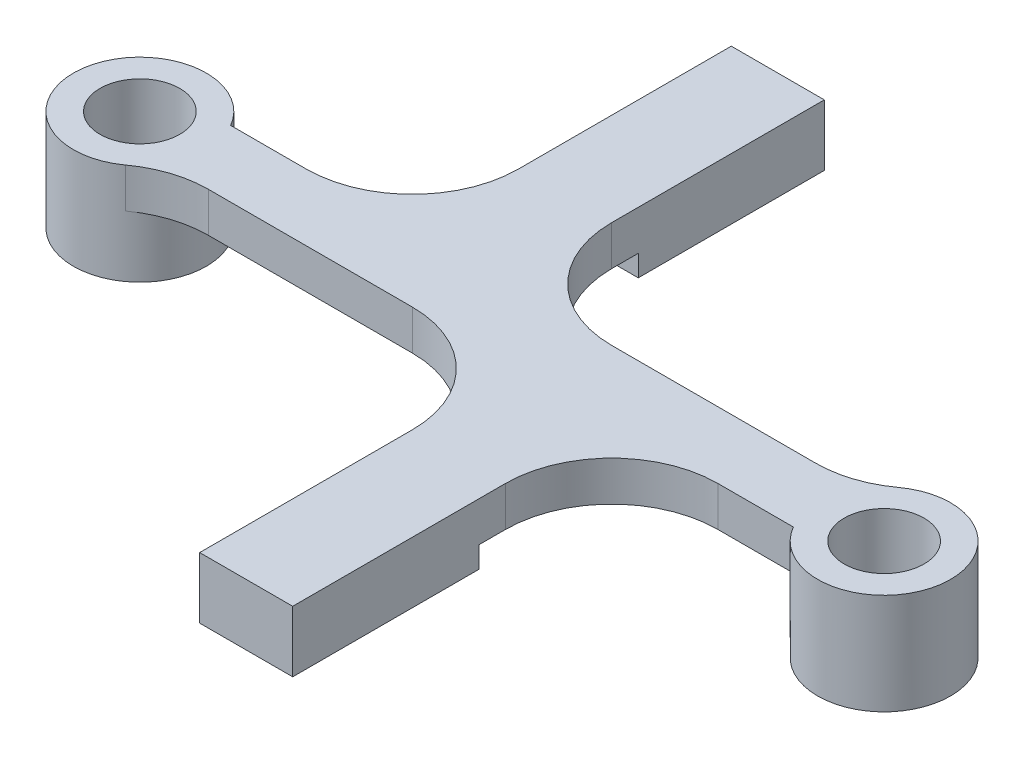
from build123d import *

# Parameters (mm, degrees)
SKETCH1_R           = 1.5
BOSS_EXTRUDE2_DEPTH = 3.8
SKETCH2_W           = 3.5
SKETCH2_H           = 7
SKETCH2_H_2         = 5
BOSS_EXTRUDE3_DEPTH = 3.8
CUT_EXTRUDE1_DEPTH  = 2.3
SKETCH4_W           = 3.5
SKETCH4_H           = 7
CUT_EXTRUDE2_DEPTH  = 1.5
FILLET1_R           = 4


with BuildPart() as part:
    # Sketch1 → Boss-Extrude2 (new body)
    # profile 1 of 5: a face of its own
    with BuildSketch(Plane(origin=(0, 0, 0), x_dir=(1, 0, 0), z_dir=(0, 1, 0))):
        with BuildLine():
            Line((-11.834936491, -1.25), (-11.834936491, 1.25))
            ThreePointArc((-11.834936491, 1.25), (-16.5, 0), (-11.834936491, -1.25))
        make_face()
        with Locations(Location((-14, 0, 0), (0, 0, 90))):
            Circle(SKETCH1_R, mode=Mode.SUBTRACT)
    # profile 2 of 5: a face of its own
    with BuildSketch(Plane(origin=(0, 0, 0), x_dir=(1, 0, 0), z_dir=(0, 1, 0))):
        with BuildLine():
            ThreePointArc((-11.5, 0), (-11.585185434, 0.647047613), (-11.834936491, 1.25))
            Line((-11.834936491, 1.25), (-11.834936491, -1.25))
            ThreePointArc((-11.834936491, -1.25), (-11.585185434, -0.647047613), (-11.5, 0))
        make_face()
    # profile 3 of 5: a face of its own
    with BuildSketch(Plane(origin=(0, 0, 0), x_dir=(1, 0, 0), z_dir=(0, 1, 0))):
        with BuildLine():
            Line((11.834936491, 1.25), (-11.834936491, 1.25))
            ThreePointArc((-11.834936491, 1.25), (-11.585185434, 0.647047613), (-11.5, 0))
            ThreePointArc((-11.5, 0), (-11.585185434, -0.647047613), (-11.834936491, -1.25))
            Line((-11.834936491, -1.25), (11.834936491, -1.25))
            ThreePointArc((11.834936491, -1.25), (11.5, 0), (11.834936491, 1.25))
        make_face()
    # profile 4 of 5: a face of its own
    with BuildSketch(Plane(origin=(0, 0, 0), x_dir=(1, 0, 0), z_dir=(0, 1, 0))):
        with BuildLine():
            Line((11.834936491, -1.25), (11.834936491, 1.25))
            ThreePointArc((11.834936491, 1.25), (11.5, 0), (11.834936491, -1.25))
        make_face()
    # profile 5 of 5: a face of its own
    with BuildSketch(Plane(origin=(0, 0, 0), x_dir=(1, 0, 0), z_dir=(0, 1, 0))):
        with BuildLine():
            ThreePointArc((16.5, 0), (14.647047613, 2.414814566), (11.834936491, 1.25))
            Line((11.834936491, 1.25), (11.834936491, -1.25))
            ThreePointArc((11.834936491, -1.25), (14.647047613, -2.414814566), (16.5, 0))
        make_face()
        with Locations(Location((14, 0, 0), (0, 0, 90))):
            Circle(SKETCH1_R, mode=Mode.SUBTRACT)
    extrude(amount=BOSS_EXTRUDE2_DEPTH)

    # Sketch2 → Boss-Extrude3 (add)
    with BuildSketch(Plane(origin=(0, 3.8, 0), x_dir=(1, 0, 0), z_dir=(0, 1, 0))):
        with Locations((-3.25, 9.75)):
            Rectangle(SKETCH2_W, SKETCH2_H)
        with Locations((-3.25, 3.75)):
            Rectangle(SKETCH2_W, SKETCH2_H_2)
        with Locations((3.25, -3.75)):
            Rectangle(SKETCH2_W, SKETCH2_H_2)
        with Locations((3.25, -9.75)):
            Rectangle(SKETCH2_W, SKETCH2_H)
    extrude(amount=-BOSS_EXTRUDE3_DEPTH)

    # Sketch3 → Cut-Extrude1 (cut)
    with BuildSketch(Plane.XZ):
        with BuildLine():
            Line((5, 6.25), (1.5, 6.25))
            Line((1.5, 6.25), (1.5, 1.25))
            Line((1.5, 1.25), (-11.834936491, 1.25))
            ThreePointArc((-11.834936491, 1.25), (-11.5, 0), (-11.834936491, -1.25))
            Line((-11.834936491, -1.25), (-5, -1.25))
            Line((-5, -1.25), (-5, -6.25))
            Line((-5, -6.25), (-1.5, -6.25))
            Line((-1.5, -6.25), (-1.5, -1.25))
            Line((-1.5, -1.25), (11.834936491, -1.25))
            ThreePointArc((11.834936491, -1.25), (11.5, 0), (11.834936491, 1.25))
            Line((11.834936491, 1.25), (5, 1.25))
            Line((5, 1.25), (5, 6.25))
        make_face()
    extrude(amount=-CUT_EXTRUDE1_DEPTH, mode=Mode.SUBTRACT)

    # Sketch4 → Cut-Extrude2 (cut)
    with BuildSketch(Plane.XZ):
        with Locations((-3.25, -9.75)):
            Rectangle(SKETCH4_W, SKETCH4_H)
        with Locations((3.25, 9.75)):
            Rectangle(SKETCH4_W, SKETCH4_H)
    extrude(amount=-CUT_EXTRUDE2_DEPTH, mode=Mode.SUBTRACT)

    # Fillet1
    # the kernel refuses this fillet: 4 mm, written as the material it adds along each edge
    with BuildSketch(Plane(origin=(11.834936491, 2.3, -1.25), x_dir=(-1, 0, 0), z_dir=(0, 1, 0))) as fillet1_piece_1:
        with BuildLine():
            CenterArc((1.66736392, -4), FILLET1_R, 90, 36.128927472)
            ThreePointArc((-0.69105296, -0.769230769), (-0.305320518, -0.420735169), (0, 0))
            Line((0, 0), (1.66736392, 0))
        make_face()
    extrude(amount=1.5)
    with BuildSketch(Plane(origin=(-11.834936491, 2.3, 1.25), x_dir=(-0.668294067479168, 0, 0.743897196776644), z_dir=(0, 1, 0))) as fillet1_piece_2:
        with BuildLine():
            CenterArc((1.861299371, 3.913523616), FILLET1_R, 221.935536264, 36.128927472)
            Line((-1.114289416, 1.240347346), (0, 0))
            ThreePointArc((0, 0), (0.517027603, 0.05404774), (1.034055206, 0))
        make_face()
    extrude(amount=1.5)
    with BuildSketch(Plane(origin=(1.5, 3.8, 1.25), x_dir=(-1, 0, 0), z_dir=(0, -1, 0)), Plane(origin=(5, 3.8, 1.25), x_dir=(0, 0, 1), z_dir=(0, -1, 0))) as fillet1_piece_3:
        with BuildLine():
            CenterArc((FILLET1_R, -FILLET1_R), FILLET1_R, 90, 90)
            Line((0, -FILLET1_R), (0, 0))
            Line((0, 0), (FILLET1_R, 0))
        make_face()
    extrude(amount=1.5)
    with BuildSketch(Plane(origin=(-5, 3.8, -1.25), x_dir=(-1, 0, 0), z_dir=(0, -1, 0)), Plane(origin=(-1.5, 3.8, -1.25), x_dir=(0, 0, -1), z_dir=(0, -1, 0))) as fillet1_piece_4:
        with BuildLine():
            CenterArc((FILLET1_R, FILLET1_R), FILLET1_R, 180, 90)
            Line((0, FILLET1_R), (0, 0))
            Line((0, 0), (FILLET1_R, 0))
        make_face()
    extrude(amount=1.5)


solid = part.part
